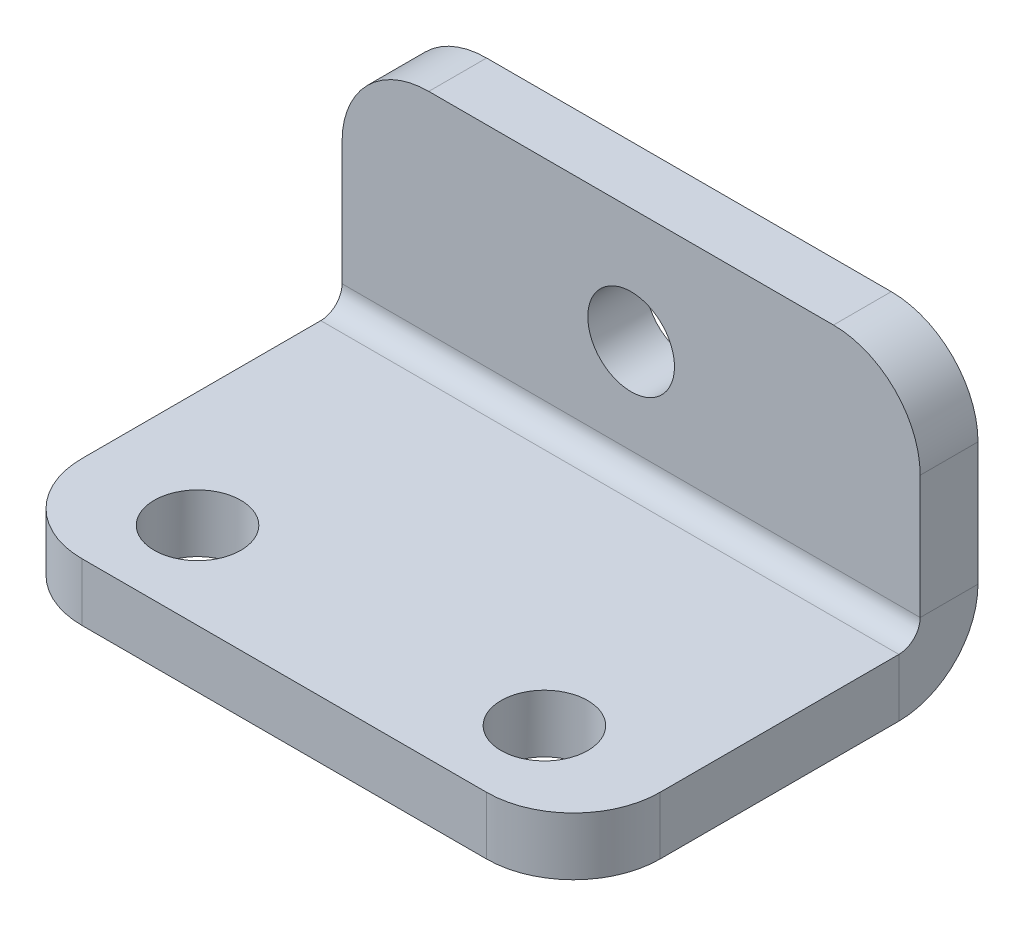
from build123d import *

# Parameters (mm, degrees)
BASE_FLANGE1_DEPTH = 10
FILLET1_R          = 3
SKETCH6_R          = 1.5
CUT_EXTRUDE1_DEPTH = 10
SKETCH7_R          = 1.5
CUT_EXTRUDE2_DEPTH = 10


# Sheet-metal steps are written as plain solids
with BuildPart() as part:
    # Sketch1 → Base-Flange1 (new, symmetric)
    with BuildSketch(Plane(origin=(0, 0, 0), x_dir=(0, 0, -1), z_dir=(1, 0, 0))):
        with BuildLine():
            Line((0, 8), (0, 0.7366))
            ThreePointArc((0, 0.7366), (-0.215745145, 0.215745145), (-0.7366, 0))
            Line((-0.7366, 0), (-12, 0))
            Line((-12, 0), (-12, -2))
            Line((-12, -2), (-0.7366, -2))
            ThreePointArc((-0.7366, -2), (1.198468417, -1.198468417), (2, 0.7366))
            Line((2, 0.7366), (2, 8))
            Line((2, 8), (0, 8))
        make_face()
    extrude(amount=BASE_FLANGE1_DEPTH, both=True)

    # Fillet1
    fillet1_edges = [part.edges().sort_by_distance(p)[0] for p in [
        (10, 8, -1),
        (10, -1, 12),
        (-10, 8, -1),
        (-10, -1, 12),
    ]]
    fillet(fillet1_edges, radius=FILLET1_R)

    # Sketch6 → Cut-Extrude1 (cut)
    with BuildSketch(Plane(origin=(0, 0, 0), x_dir=(1, 0, 0), z_dir=(0, 1, 0))):
        with Locations(Location((6, -9, 0), (0, 0, 270))):
            Circle(SKETCH6_R)
        with Locations(Location((-6, -9, 0), (0, 0, 270))):
            Circle(SKETCH6_R)
    extrude(amount=-CUT_EXTRUDE1_DEPTH, mode=Mode.SUBTRACT)

    # Sketch7 → Cut-Extrude2 (cut)
    with BuildSketch(Plane.XY):
        with Locations((0, 4)):
            Circle(SKETCH7_R)
    extrude(amount=-CUT_EXTRUDE2_DEPTH, mode=Mode.SUBTRACT)


solid = part.part
